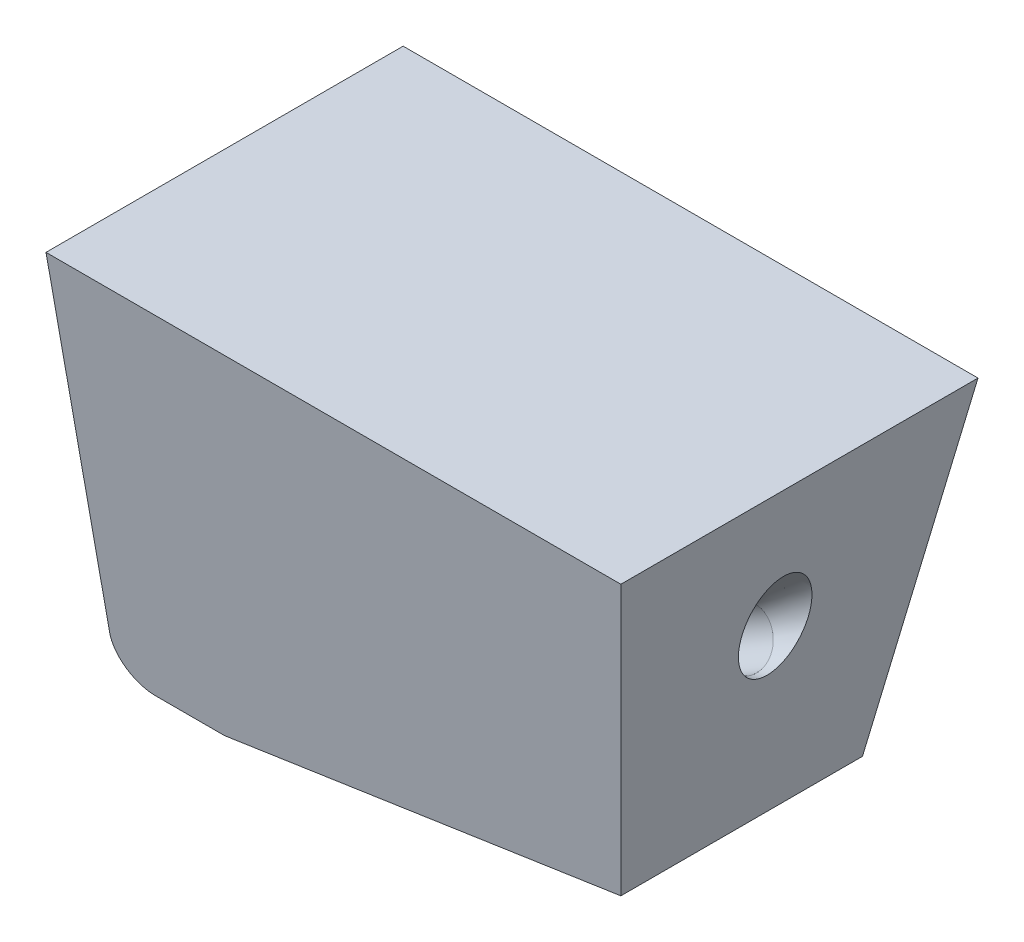
from build123d import *

# Parameters (mm, degrees)
TD_SKETCH_R                             = 0.79248
TL_FEATURE_DEPTH                        = 21.0312
TDF_STD_SKETCH_W                        = 1.60495996
TDF_STD_SKETCH_H                        = 1.60495996
TDF_STD_FEATURE_DEPTH                   = 22.061040395
ISA_20_STD_FEATURE_DEPTH                = 22.061040395
ISA_20_STD_FEATURE_DEPTH_BACK           = 22.061040395
F_10BA_STD_FEATURE_DEPTH                = 22.061040395
F_10BA_STD_FEATURE_DEPTH_BACK           = 22.061040395
ERW_STD_FEATURE_DEPTH                   = 0.01905
H_STD_FEATURE_START                     = -0.299236296
H_STD_FEATURE_OUTLINE_R                 = 0.01905
H_STD_FEATURE_DEPTH                     = 0.299236296
H_STD_FEATURE_START_2                   = -0.291139417
H_STD_FEATURE_2_OUTLINE_R               = 0.01905
H_STD_FEATURE_2_DEPTH                   = 0.065991236
H_STD_FEATURE_START_3                   = -1
H_STD_FEATURE_3_OUTLINE_W               = 3
H_STD_FEATURE_3_OUTLINE_H               = 4
H_STD_FEATURE_3_DEPTH                   = 1
H_STD_CUT_FEATURE_DEPTH                 = 22.061040395
H_STD_CUT_FEATURE_DEPTH_BACK            = 22.061040395
H_STD_SKETCH_3_R                        = 0.01905
FUNNEL_FINAL_DIAMETRE_STD_FEATURE_DEPTH = 2.499995
FUNNEL_FINAL_DIAMETRE_STD_FEATURE_DRAFT = -13
ROUND_BR_STD_FEATURE_START              = -1
ROUND_BR_STD_FEATURE_DEPTH              = 1.009339363
FRO_STD_FEATURE_DEPTH                   = 22.061040395
FRO_STD_FEATURE_DEPTH_BACK              = 22.061040395


with BuildPart() as part:
    # TD_sketch → TL_feature (new body)
    with BuildSketch(Plane(origin=(0, 0, 0), x_dir=(1, 0, 0), z_dir=(0, 1, 0))):
        with Locations(Location((0, 0, 0), (0, 0, 270))):
            Circle(TD_SKETCH_R)
    extrude(amount=TL_FEATURE_DEPTH)

    # TDF_STD_sketch → TDF_STD_feature (cut, through all)
    with BuildSketch(Plane(origin=(0, 0, 0), x_dir=(1, 0, 0), z_dir=(0, 1, 0))):
        with Locations((-1.17839998, 0)):
            Rectangle(TDF_STD_SKETCH_W, TDF_STD_SKETCH_H)
    extrude(amount=TDF_STD_FEATURE_DEPTH, mode=Mode.SUBTRACT)

    # ISA_20_STD_sketch → ISA_20_STD_feature (cut, two sides: drawn at the far end of the back side and taken through both)
    with BuildSketch(Plane(origin=(0, 0, 0), x_dir=(0, 0, -1), z_dir=(1, 0, 0)).offset(-ISA_20_STD_FEATURE_DEPTH_BACK)):
        Polygon((-12.996080373, 73.27228267), (-3.784567997, 21.0312), (-0.0762, 0), (0.0762, 0), (3.784567997, 21.0312), (12.996080373, 73.27228267), (12.996080373, -32.821688483), (-12.996080373, -32.821688483), align=None)
    extrude(amount=ISA_20_STD_FEATURE_DEPTH + ISA_20_STD_FEATURE_DEPTH_BACK, mode=Mode.SUBTRACT)

    # 10BA_STD_sketch → 10BA_STD_feature (cut, two sides: drawn at the far end of the back side and taken through both)
    with BuildSketch(Plane.XY.offset(-F_10BA_STD_FEATURE_DEPTH_BACK)):
        Polygon((-53.216424634, 0), (-0.37592, 0), (-0.29972, 0), (-0.011354365, 0.050846642), (3.688047997, 21.0312), (12.863705333, 73.068938636), (91.245889802, 2.18375769), (25.165759835, -70.885180946), align=None)
    extrude(amount=F_10BA_STD_FEATURE_DEPTH + F_10BA_STD_FEATURE_DEPTH_BACK, mode=Mode.SUBTRACT)


with BuildPart() as body_2:
    # ERW_STD_sketch → ERW_STD_feature (new, symmetric)
    with BuildSketch(Plane.XY):
        Polygon((-0.1397, 0.09144), (-0.1397, 0), (-0.32512, 0), (-0.272327091, 0.09144), align=None)
    extrude(amount=ERW_STD_FEATURE_DEPTH, both=True)


with BuildPart() as body_3:
    # H_STD_feature: read off the stored shape, not the designer's step
    # H_STD_feature outline → H_STD_feature (new body)
    with BuildSketch(Plane(origin=(-0.010357492, 0.166115932, 0), x_dir=(0, 0, -1), z_dir=(0.8660254037844415, 0.4999999999999953, 0)).offset(H_STD_FEATURE_START)):
        Circle(H_STD_FEATURE_OUTLINE_R)
    extrude(amount=H_STD_FEATURE_DEPTH)

    # H_STD_feature 2 outline → H_STD_feature 2 (add)
    with BuildSketch(Plane(origin=(0, 0, 0), x_dir=(0.4999999999999952, -0.8660254037844414, 0), z_dir=(0.8660254037844414, 0.4999999999999952, 0)).offset(H_STD_FEATURE_START_2)):
        with Locations((-0.149039363, 0)):
            Circle(H_STD_FEATURE_2_OUTLINE_R)
    extrude(amount=H_STD_FEATURE_2_DEPTH)

    # H_STD_feature 3 outline → H_STD_feature 3 (cut)
    with BuildSketch(Plane(origin=(0, 0, 0), x_dir=(1, 0, 0), z_dir=(0, 1, 0)).offset(H_STD_FEATURE_START_3)):
        with Locations((-0.5, 0)):
            Rectangle(H_STD_FEATURE_3_OUTLINE_W, H_STD_FEATURE_3_OUTLINE_H)
    extrude(amount=H_STD_FEATURE_3_DEPTH, mode=Mode.SUBTRACT)

    # H_STD_cut_sketch → H_STD_cut_feature (cut, two sides: drawn at the far end of the back side and taken through both)
    with BuildSketch(Plane.XY.offset(-H_STD_CUT_FEATURE_DEPTH_BACK)):
        Polygon((-52.376024458, 0.09144), (-0.272327091, 0.09144), (-0.1397, 0.09144), (-0.1397, 0), (-0.1397, -52.103697367), (-73.796388553, -125.818508284), (-126.032713012, -73.623370917), align=None)
    extrude(amount=H_STD_CUT_FEATURE_DEPTH + H_STD_CUT_FEATURE_DEPTH_BACK, mode=Mode.SUBTRACT)


with BuildPart() as body_2_1:
    add(body_2.part)

    # H_STD_fix_feature: union body 3
    add(body_3.part)


with BuildPart() as funnel_final_diametre_std_feature_tool:
    # H_STD_sketch<3> → funnel_final_diametre_STD_feature (with draft: the straight prism first)
    with BuildSketch(Plane(origin=(-0.010357492, 0.166115932, 0), x_dir=(0, 0, -1), z_dir=(0.8660254037844415, 0.4999999999999953, 0))):
        with Locations(Location((0, 0, 0), (0, 0, 90))):
            Circle(H_STD_SKETCH_3_R)
    extrude(amount=FUNNEL_FINAL_DIAMETRE_STD_FEATURE_DEPTH)
    # funnel_final_diametre_STD_feature: the draft: its side faces are tilted about the plane it starts from
    funnel_final_diametre_std_feature_sides = [funnel_final_diametre_std_feature_tool.faces().sort_by_distance(p)[0] for p in [
        (1.081697098, 0.774616898, 0),
    ]]
    draft(funnel_final_diametre_std_feature_sides, Plane(origin=(-0.010357492, 0.166115932, 0), x_dir=(0, 0, -1), z_dir=(0.8660254037844415, 0.4999999999999953, 0)), FUNNEL_FINAL_DIAMETRE_STD_FEATURE_DRAFT)


with BuildPart() as body_2_2:
    add(body_2_1.part)

    # funnel_final_diametre_STD_feature: add funnel_final_diametre_std_feature_tool
    add(funnel_final_diametre_std_feature_tool.part)

    # ROUND_BR_STD_feature: read off the stored shape, not the designer's step
    # ROUND_BR_STD_feature outline → ROUND_BR_STD_feature (cut)
    with BuildSketch(Plane(origin=(0, 0, 0), x_dir=(0.8660254037844362, -0.5000000000000042, 0), z_dir=(0.5000000000000042, 0.8660254037844363, 0)).offset(ROUND_BR_STD_FEATURE_START)):
        with BuildLine():
            Line((-0.281562179, -0.01905), (-0.262512179, -0.01905))
            ThreePointArc((-0.262512179, -0.01905), (-0.275982563, -0.013470384), (-0.281562179, 0))
            Line((-0.281562179, 0), (-0.281562179, -0.01905))
        make_face()
        with BuildLine():
            Line((-0.281562179, 0.01905), (-0.281562179, 0))
            ThreePointArc((-0.281562179, 0), (-0.275982563, 0.013470384), (-0.262512179, 0.01905))
            Line((-0.262512179, 0.01905), (-0.281562179, 0.01905))
        make_face()
    extrude(amount=ROUND_BR_STD_FEATURE_DEPTH, mode=Mode.SUBTRACT)


with BuildPart() as part_1:
    add(part.part)

    # COMBINE_STD_feature: cut body 2
    add(body_2_2.part, mode=Mode.SUBTRACT)

    # FRO_STD_sketch → FRO_STD_feature (cut, two sides: drawn at the far end of the back side and taken through both)
    with BuildSketch(Plane.XY.offset(-FRO_STD_FEATURE_DEPTH_BACK)):
        with BuildLine():
            Line((-0.3760216, 52.152149391), (-0.3760216, 0.02794))
            ThreePointArc((-0.3760216, 0.02794), (-0.367838163, 0.008183437), (-0.3480816, 0))
            Line((-0.3480816, 0), (51.776127791, 0))
            Line((51.776127791, 0), (-21.938636058, -73.714763849))
            Line((-21.938636058, -73.714763849), (-74.090785449, -21.562614458))
            Line((-74.090785449, -21.562614458), (-0.3760216, 52.152149391))
        make_face()
    extrude(amount=FRO_STD_FEATURE_DEPTH + FRO_STD_FEATURE_DEPTH_BACK, mode=Mode.SUBTRACT)

    # cut_feature
    split(bisect_by=Plane(origin=(0, 0.281844732, 0), x_dir=(1, 0, 0), z_dir=(0, 1, 0)), keep=Keep.BOTTOM)


solid = part_1.part
